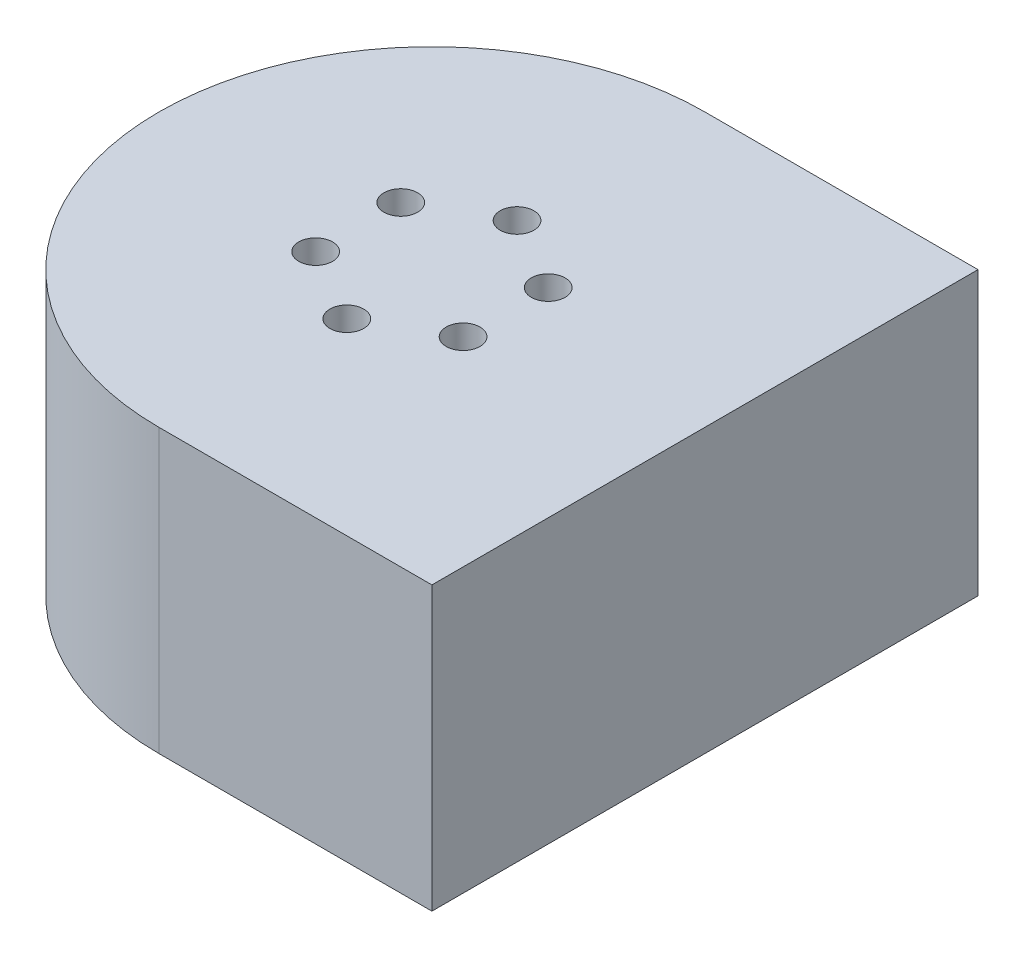
from build123d import *

# Parameters (mm, degrees)
BOSS_EXTRUDE1_DEPTH = 46
SKETCH2_R           = 2.75
CUT_EXTRUDE2_DEPTH  = 76


with BuildPart() as part:
    # Sketch1 → Boss-Extrude1 (new body)
    with BuildSketch(Plane(origin=(0, 0, 0), x_dir=(1, 0, 0), z_dir=(0, 1, 0))):
        with BuildLine():
            Line((0, 44.45), (44.45, 44.45))
            Line((44.45, 44.45), (44.45, -44.45))
            Line((44.45, -44.45), (0, -44.45))
            ThreePointArc((0, -44.45), (-44.45, 0), (0, 44.45))
        make_face()
    extrude(amount=BOSS_EXTRUDE1_DEPTH)

    # Sketch2 → Cut-Extrude2 (cut)
    with BuildSketch(Plane(origin=(0, 0, 0), x_dir=(-1, 0, 0), z_dir=(0, -1, 0))):
        with Locations((0, -13.856406461)):
            Circle(SKETCH2_R)
        with Locations((12, -6.92820323)):
            Circle(SKETCH2_R)
        with Locations((-12, -6.92820323)):
            Circle(SKETCH2_R)
        with Locations((12, 6.92820323)):
            Circle(SKETCH2_R)
        with Locations((-12, 6.92820323)):
            Circle(SKETCH2_R)
        with Locations((0, 13.856406461)):
            Circle(SKETCH2_R)
    extrude(amount=-CUT_EXTRUDE2_DEPTH, mode=Mode.SUBTRACT)


solid = part.part
